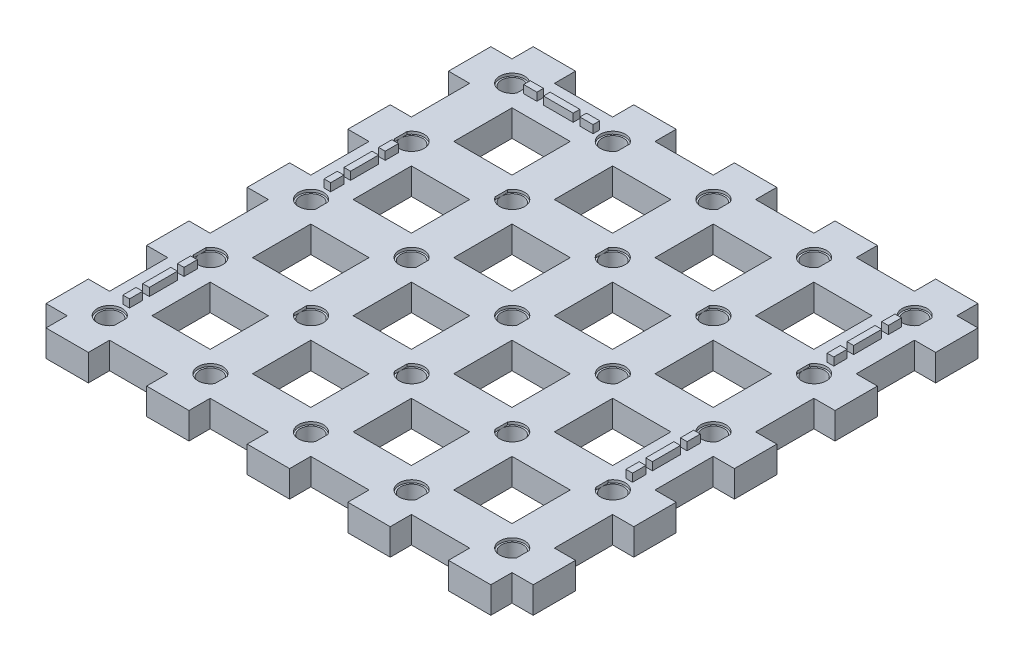
from build123d import *

# Parameters (mm, degrees)
SKETCH1_W           = 220
SKETCH1_H           = 220
BOSS_EXTRUDE1_DEPTH = 10
SKETCH2_R           = 4.075
CUT_EXTRUDE1_DEPTH  = 10
CUT_EXTRUDE2_DEPTH  = 1
SKETCH4_W           = 220
SKETCH4_H           = 220
SKETCH4_W_2         = 22
SKETCH4_H_2         = 22
CUT_EXTRUDE3_DEPTH  = 156.884572681
SKETCH5_W           = 5
SKETCH5_H           = 2.5
SKETCH5_W_2         = 11.225
SKETCH5_H_2         = 2.509475446
SKETCH5_W_3         = 2.5
SKETCH5_H_3         = 5
SKETCH5_H_4         = 10.6
BOSS_EXTRUDE2_DEPTH = 3


with BuildPart() as part:
    # Sketch1 → Boss-Extrude1 (new body)
    with BuildSketch(Plane(origin=(0, 0, 0), x_dir=(1, 0, 0), z_dir=(0, 1, 0))):
        Rectangle(SKETCH1_W, SKETCH1_H)
    extrude(amount=BOSS_EXTRUDE1_DEPTH)

    # Sketch2 → Cut-Extrude1 (cut)
    with BuildSketch(Plane(origin=(0, 10, 0), x_dir=(1, 0, 0), z_dir=(0, 1, 0))):
        with Locations((-76, -75.925)):
            Circle(SKETCH2_R)
        with Locations((-38, -75.925)):
            Circle(SKETCH2_R)
        with Locations((0, -75.925)):
            Circle(SKETCH2_R)
        with Locations((38, -75.925)):
            Circle(SKETCH2_R)
        with Locations((76, -75.925)):
            Circle(SKETCH2_R)
        with Locations((-76, -37.925)):
            Circle(SKETCH2_R)
        with Locations((-38, -37.925)):
            Circle(SKETCH2_R)
        with Locations((0, -37.925)):
            Circle(SKETCH2_R)
        with Locations((38, -37.925)):
            Circle(SKETCH2_R)
        with Locations((76, -37.925)):
            Circle(SKETCH2_R)
        with Locations((-76, 0.075)):
            Circle(SKETCH2_R)
        with Locations((-38, 0.075)):
            Circle(SKETCH2_R)
        with Locations((0, 0.075)):
            Circle(SKETCH2_R)
        with Locations((38, 0.075)):
            Circle(SKETCH2_R)
        with Locations((76, 0.075)):
            Circle(SKETCH2_R)
        with Locations((-76, 38.075)):
            Circle(SKETCH2_R)
        with Locations((-38, 38.075)):
            Circle(SKETCH2_R)
        with Locations((0, 38.075)):
            Circle(SKETCH2_R)
        with Locations((38, 38.075)):
            Circle(SKETCH2_R)
        with Locations((76, 38.075)):
            Circle(SKETCH2_R)
        with Locations((-76, 76.075)):
            Circle(SKETCH2_R)
        with Locations((-38, 76.075)):
            Circle(SKETCH2_R)
        with Locations((0, 76.075)):
            Circle(SKETCH2_R)
        with Locations((38, 76.075)):
            Circle(SKETCH2_R)
        with Locations((76, 76.075)):
            Circle(SKETCH2_R)
    extrude(amount=-CUT_EXTRUDE1_DEPTH, mode=Mode.SUBTRACT)

    # Sketch3 → Cut-Extrude2 (cut)
    with BuildSketch(Plane(origin=(0, 10, 0), x_dir=(1, 0, 0), z_dir=(0, 1, 0))):
        with BuildLine():
            Line((-71.925, -78.266874249), (-71.925, -73.583125751))
            ThreePointArc((-71.925, -73.583125751), (-80.7, -75.925), (-71.925, -78.266874249))
        make_face()
        with BuildLine():
            Line((-80.075, -35.583125751), (-80.075, -40.266874249))
            ThreePointArc((-80.075, -40.266874249), (-71.3, -37.925), (-80.075, -35.583125751))
        make_face()
        with BuildLine():
            Line((-71.925, -2.266874249), (-71.925, 2.416874249))
            ThreePointArc((-71.925, 2.416874249), (-80.7, 0.075), (-71.925, -2.266874249))
        make_face()
        with BuildLine():
            Line((-80.075, 40.416874249), (-80.075, 35.733125751))
            ThreePointArc((-80.075, 35.733125751), (-71.3, 38.075), (-80.075, 40.416874249))
        make_face()
        with BuildLine():
            Line((-71.925, 73.733125751), (-71.925, 78.416874249))
            ThreePointArc((-71.925, 78.416874249), (-80.7, 76.075), (-71.925, 73.733125751))
        make_face()
        with BuildLine():
            Line((-33.925, 73.733125751), (-33.925, 78.416874249))
            ThreePointArc((-33.925, 78.416874249), (-42.7, 76.075), (-33.925, 73.733125751))
        make_face()
        with BuildLine():
            Line((-42.075, 40.416874249), (-42.075, 35.733125751))
            ThreePointArc((-42.075, 35.733125751), (-33.3, 38.075), (-42.075, 40.416874249))
        make_face()
        with BuildLine():
            Line((-33.925, -2.266874249), (-33.925, 2.416874249))
            ThreePointArc((-33.925, 2.416874249), (-42.7, 0.075), (-33.925, -2.266874249))
        make_face()
        with BuildLine():
            Line((-33.925, -78.266874249), (-33.925, -73.583125751))
            ThreePointArc((-33.925, -73.583125751), (-42.7, -75.925), (-33.925, -78.266874249))
        make_face()
        with BuildLine():
            Line((-42.075, -35.583125751), (-42.075, -40.266874249))
            ThreePointArc((-42.075, -40.266874249), (-33.3, -37.925), (-42.075, -35.583125751))
        make_face()
        with BuildLine():
            Line((4.075, 73.733125751), (4.075, 78.416874249))
            ThreePointArc((4.075, 78.416874249), (-4.7, 76.075), (4.075, 73.733125751))
        make_face()
        with BuildLine():
            Line((-4.075, 40.416874249), (-4.075, 35.733125751))
            ThreePointArc((-4.075, 35.733125751), (4.7, 38.075), (-4.075, 40.416874249))
        make_face()
        with BuildLine():
            Line((4.075, -2.266874249), (4.075, 2.416874249))
            ThreePointArc((4.075, 2.416874249), (-4.7, 0.075), (4.075, -2.266874249))
        make_face()
        with BuildLine():
            Line((4.075, -78.266874249), (4.075, -73.583125751))
            ThreePointArc((4.075, -73.583125751), (-4.7, -75.925), (4.075, -78.266874249))
        make_face()
        with BuildLine():
            Line((-4.075, -35.583125751), (-4.075, -40.266874249))
            ThreePointArc((-4.075, -40.266874249), (4.7, -37.925), (-4.075, -35.583125751))
        make_face()
        with BuildLine():
            Line((42.075, 73.733125751), (42.075, 78.416874249))
            ThreePointArc((42.075, 78.416874249), (33.3, 76.075), (42.075, 73.733125751))
        make_face()
        with BuildLine():
            Line((33.925, 40.416874249), (33.925, 35.733125751))
            ThreePointArc((33.925, 35.733125751), (42.7, 38.075), (33.925, 40.416874249))
        make_face()
        with BuildLine():
            Line((42.075, -2.266874249), (42.075, 2.416874249))
            ThreePointArc((42.075, 2.416874249), (33.3, 0.075), (42.075, -2.266874249))
        make_face()
        with BuildLine():
            Line((42.075, -78.266874249), (42.075, -73.583125751))
            ThreePointArc((42.075, -73.583125751), (33.3, -75.925), (42.075, -78.266874249))
        make_face()
        with BuildLine():
            Line((33.925, -35.583125751), (33.925, -40.266874249))
            ThreePointArc((33.925, -40.266874249), (42.7, -37.925), (33.925, -35.583125751))
        make_face()
        with BuildLine():
            Line((80.075, 73.733125751), (80.075, 78.416874249))
            ThreePointArc((80.075, 78.416874249), (71.3, 76.075), (80.075, 73.733125751))
        make_face()
        with BuildLine():
            Line((71.925, 40.416874249), (71.925, 35.733125751))
            ThreePointArc((71.925, 35.733125751), (80.7, 38.075), (71.925, 40.416874249))
        make_face()
        with BuildLine():
            Line((80.075, -2.266874249), (80.075, 2.416874249))
            ThreePointArc((80.075, 2.416874249), (71.3, 0.075), (80.075, -2.266874249))
        make_face()
        with BuildLine():
            Line((80.075, -78.266874249), (80.075, -73.583125751))
            ThreePointArc((80.075, -73.583125751), (71.3, -75.925), (80.075, -78.266874249))
        make_face()
        with BuildLine():
            Line((71.925, -35.583125751), (71.925, -40.266874249))
            ThreePointArc((71.925, -40.266874249), (80.7, -37.925), (71.925, -35.583125751))
        make_face()
    extrude(amount=-CUT_EXTRUDE2_DEPTH, mode=Mode.SUBTRACT)

    # Sketch4 → Cut-Extrude3 (cut, through all)
    # profile 1 of 17: a face of its own
    with BuildSketch(Plane(origin=(0, 10, 0), x_dir=(1, 0, 0), z_dir=(0, 1, 0))):
        Rectangle(SKETCH4_W, SKETCH4_H)
        Polygon((-68, 92), (-68, 84), (-46, 84), (-46, 92), (-30, 92), (-30, 84), (-8, 84), (-8, 92), (8, 92), (8, 84), (30, 84), (30, 92), (46, 92), (46, 84), (68, 84), (68, 92), (84, 92), (84, 84), (92, 84), (92, 68), (84, 68), (84, 46), (92, 46), (92, 30), (84, 30), (84, 8), (92, 8), (92, -8), (84, -8), (84, -30), (92, -30), (92, -46), (84, -46), (84, -68), (92, -68), (92, -84), (84, -84), (84, -92), (68, -92), (68, -84), (46, -84), (46, -92), (30, -92), (30, -84), (8, -84), (8, -92), (-8, -92), (-8, -84), (-30, -84), (-30, -92), (-46, -92), (-46, -84), (-68, -84), (-68, -92), (-84, -92), (-84, -84), (-92, -84), (-92, -68), (-84, -68), (-84, -46), (-92, -46), (-92, -30), (-84, -30), (-84, -8), (-92, -8), (-92, 8), (-84, 8), (-84, 30), (-92, 30), (-92, 46), (-84, 46), (-84, 68), (-92, 68), (-92, 84), (-84, 84), (-84, 92), align=None, mode=Mode.SUBTRACT)
    # profile 2 of 17: a face of its own
    with BuildSketch(Plane(origin=(0, 10, 0), x_dir=(1, 0, 0), z_dir=(0, 1, 0))):
        with Locations((-57, -57)):
            Rectangle(SKETCH4_W_2, SKETCH4_H_2)
    # profile 3 of 17: a face of its own
    with BuildSketch(Plane(origin=(0, 10, 0), x_dir=(1, 0, 0), z_dir=(0, 1, 0))):
        with Locations((57, -57)):
            Rectangle(SKETCH4_W_2, SKETCH4_H_2)
    # profile 4 of 17: a face of its own
    with BuildSketch(Plane(origin=(0, 10, 0), x_dir=(1, 0, 0), z_dir=(0, 1, 0))):
        with Locations((19, -57)):
            Rectangle(SKETCH4_W_2, SKETCH4_H_2)
    # profile 5 of 17: a face of its own
    with BuildSketch(Plane(origin=(0, 10, 0), x_dir=(1, 0, 0), z_dir=(0, 1, 0))):
        with Locations((-19, -57)):
            Rectangle(SKETCH4_W_2, SKETCH4_H_2)
    # profile 6 of 17: a face of its own
    with BuildSketch(Plane(origin=(0, 10, 0), x_dir=(1, 0, 0), z_dir=(0, 1, 0))):
        with Locations((-57, -19)):
            Rectangle(SKETCH4_W_2, SKETCH4_H_2)
    # profile 7 of 17: a face of its own
    with BuildSketch(Plane(origin=(0, 10, 0), x_dir=(1, 0, 0), z_dir=(0, 1, 0))):
        with Locations((57, -19)):
            Rectangle(SKETCH4_W_2, SKETCH4_H_2)
    # profile 8 of 17: a face of its own
    with BuildSketch(Plane(origin=(0, 10, 0), x_dir=(1, 0, 0), z_dir=(0, 1, 0))):
        with Locations((19, -19)):
            Rectangle(SKETCH4_W_2, SKETCH4_H_2)
    # profile 9 of 17: a face of its own
    with BuildSketch(Plane(origin=(0, 10, 0), x_dir=(1, 0, 0), z_dir=(0, 1, 0))):
        with Locations((-19, -19)):
            Rectangle(SKETCH4_W_2, SKETCH4_H_2)
    # profile 10 of 17: a face of its own
    with BuildSketch(Plane(origin=(0, 10, 0), x_dir=(1, 0, 0), z_dir=(0, 1, 0))):
        with Locations((-57, 19)):
            Rectangle(SKETCH4_W_2, SKETCH4_H_2)
    # profile 11 of 17: a face of its own
    with BuildSketch(Plane(origin=(0, 10, 0), x_dir=(1, 0, 0), z_dir=(0, 1, 0))):
        with Locations((57, 19)):
            Rectangle(SKETCH4_W_2, SKETCH4_H_2)
    # profile 12 of 17: a face of its own
    with BuildSketch(Plane(origin=(0, 10, 0), x_dir=(1, 0, 0), z_dir=(0, 1, 0))):
        with Locations((19, 19)):
            Rectangle(SKETCH4_W_2, SKETCH4_H_2)
    # profile 13 of 17: a face of its own
    with BuildSketch(Plane(origin=(0, 10, 0), x_dir=(1, 0, 0), z_dir=(0, 1, 0))):
        with Locations((-19, 19)):
            Rectangle(SKETCH4_W_2, SKETCH4_H_2)
    # profile 14 of 17: a face of its own
    with BuildSketch(Plane(origin=(0, 10, 0), x_dir=(1, 0, 0), z_dir=(0, 1, 0))):
        with Locations((57, 57)):
            Rectangle(SKETCH4_W_2, SKETCH4_H_2)
    # profile 15 of 17: a face of its own
    with BuildSketch(Plane(origin=(0, 10, 0), x_dir=(1, 0, 0), z_dir=(0, 1, 0))):
        with Locations((19, 57)):
            Rectangle(SKETCH4_W_2, SKETCH4_H_2)
    # profile 16 of 17: a face of its own
    with BuildSketch(Plane(origin=(0, 10, 0), x_dir=(1, 0, 0), z_dir=(0, 1, 0))):
        with Locations((-19, 57)):
            Rectangle(SKETCH4_W_2, SKETCH4_H_2)
    # profile 17 of 17: a face of its own
    with BuildSketch(Plane(origin=(0, 10, 0), x_dir=(1, 0, 0), z_dir=(0, 1, 0))):
        with Locations((-57, 57)):
            Rectangle(SKETCH4_W_2, SKETCH4_H_2)
    extrude(amount=-CUT_EXTRUDE3_DEPTH, mode=Mode.SUBTRACT)

    # Sketch5 → Boss-Extrude2 (add)
    with BuildSketch(Plane(origin=(0, 10, 0), x_dir=(1, 0, 0), z_dir=(0, 1, 0))):
        with Locations((-67.925, 76.071395089)):
            Rectangle(SKETCH5_W, SKETCH5_H)
        with Locations((-46.7, 76.071395089)):
            Rectangle(SKETCH5_W, SKETCH5_H)
        with Locations((-57.3125, 76.066657366)):
            Rectangle(SKETCH5_W_2, SKETCH5_H_2)
        with Locations((76, 67.375)):
            Rectangle(SKETCH5_W_3, SKETCH5_H_3)
        with Locations((76, 57.075)):
            Rectangle(SKETCH5_W_3, SKETCH5_H_4)
        with Locations((76, 46.775)):
            Rectangle(SKETCH5_W_3, SKETCH5_H_3)
        with Locations((-76, 29.375)):
            Rectangle(SKETCH5_W_3, SKETCH5_H_3)
        with Locations((-76, 19.075)):
            Rectangle(SKETCH5_W_3, SKETCH5_H_4)
        with Locations((-76, 8.775)):
            Rectangle(SKETCH5_W_3, SKETCH5_H_3)
        with Locations((76, -8.625)):
            Rectangle(SKETCH5_W_3, SKETCH5_H_3)
        with Locations((76, -18.925)):
            Rectangle(SKETCH5_W_3, SKETCH5_H_4)
        with Locations((76, -29.225)):
            Rectangle(SKETCH5_W_3, SKETCH5_H_3)
        with Locations((-76, -46.625)):
            Rectangle(SKETCH5_W_3, SKETCH5_H_3)
        with Locations((-76, -56.925)):
            Rectangle(SKETCH5_W_3, SKETCH5_H_4)
        with Locations((-76, -67.225)):
            Rectangle(SKETCH5_W_3, SKETCH5_H_3)
    extrude(amount=BOSS_EXTRUDE2_DEPTH)


solid = part.part
